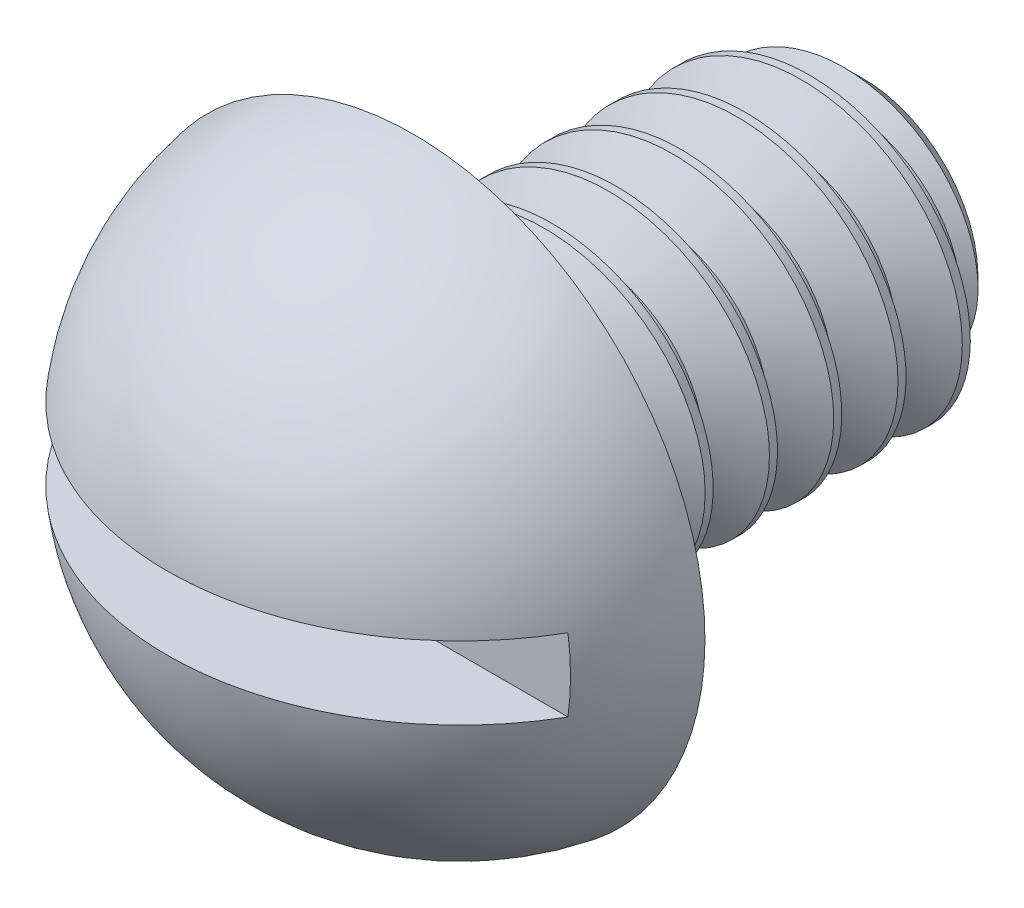
from build123d import *

# Parameters (mm, degrees)
SKETCH3_W          = 6.1722
SKETCH3_H          = 0.51435
CUT_EXTRUDE1_DEPTH = 1.05156
CHAMFER2_SIZE      = 0.03175
SPLIT1_START       = -2.4638
SPLIT1_OUTLINE_R   = 1.0922
SPLIT1_DEPTH       = 3.1115
CUT_SWEEP1_PITCH   = 0.453571429
CUT_SWEEP1_TO      = 3.1115


with BuildPart() as part:
    # Sketch2 → Revolve1 (revolve)
    with BuildSketch(Plane(origin=(0, 0, 0), x_dir=(0, 0, -1), z_dir=(1, 0, 0)), mode=Mode.PRIVATE) as revolve1_sk:
        with BuildLine():
            Line((-2.4638, 0), (2.4638, 0))
            Line((2.4638, 0), (2.4638, 0.808717857))
            Line((2.4638, 0.808717857), (2.180317857, 1.0922))
            Line((2.180317857, 1.0922), (-0.6477, 1.0922))
            Line((-0.6477, 1.0922), (-0.6477, 1.114044))
            Line((-0.6477, 1.114044), (-0.7112, 1.114044))
            Line((-0.7112, 1.114044), (-0.7112, 2.0574))
            ThreePointArc((-0.7112, 2.0574), (-1.96625373, 1.351342066), (-2.4638, 0))
        make_face()
    revolve(revolve1_sk.sketch.rotate(Axis((0, 0, 2.4638), (0, 0, -1)), 180), axis=Axis((0, 0, 2.4638), (0, 0, -1)))

    # Sketch3 → Cut-Extrude1 (cut)
    with BuildSketch(Plane.XY.offset(2.4638)):
        Rectangle(SKETCH3_W, SKETCH3_H)
    extrude(amount=-CUT_EXTRUDE1_DEPTH, mode=Mode.SUBTRACT)

    # Chamfer2
    chamfer2_edges = [part.edges().sort_by_distance(p)[0] for p in [
        (0, 1.114044, 0.7112),
    ]]
    chamfer(chamfer2_edges, length=CHAMFER2_SIZE)

    # Split1: read off the stored shape, not the designer's step
    # Split1 outline → Split1 (cut)
    with BuildSketch(Plane.XY.offset(SPLIT1_START)):
        Circle(SPLIT1_OUTLINE_R)
    extrude(amount=SPLIT1_DEPTH, mode=Mode.SUBTRACT)



with BuildPart() as body_2:
    # Split1 2 outline → Split1 2 (revolve)
    with BuildSketch(Plane.XZ):
        Polygon((1.0922, 0.6477), (0, 0.6477), (0, -2.4638), (0.808717857, -2.4638), (1.0922, -2.180317857), align=None)
    revolve(axis=Axis((0, 0, 0), (0, 0, 1)))

    # Cut-Sweep1: arcs per turn and ends read off the stored shape
    # Cut-Sweep1: the profile of Sketch5 screwed along a right-hand helix through 8 turns, 6 arcs to a turn; built about Z, then put on its axis
    cut_sweep1_z = Axis((0, 0, 0), (0, 0, 1))
    cut_sweep1_corners = [(0.797596715, 0, -0.170089286), (0.797596715, 0, -0.226785714), (1.116750274, 0, -0.411049107), (1.116750274, 0, 0.014174107)]
    with BuildLine(mode=Mode.PRIVATE) as cut_sweep1_profile:
        Line(cut_sweep1_corners[0], cut_sweep1_corners[1])
        Line(cut_sweep1_corners[1], cut_sweep1_corners[2])
        Line(cut_sweep1_corners[2], cut_sweep1_corners[3])
        Line(cut_sweep1_corners[3], cut_sweep1_corners[0])
    cut_sweep1_cap = Face(cut_sweep1_profile.wire())
    cut_sweep1_turn_angles = [0, 30, 60, 90, 120, 150, 180, 210, 240, 270, 300, 330, 360]
    cut_sweep1_turn_weights = [1, 0.8660254037844387, 1, 0.8660254037844387, 1, 0.8660254037844387, 1, 0.8660254037844387, 1, 0.8660254037844387, 1, 0.8660254037844387, 1]
    cut_sweep1_turn_rails = [Edge.make_bspline([Vector(p[0], p[1], 0).rotate(cut_sweep1_z, cut_sweep1_turn_angles[k]) / cut_sweep1_turn_weights[k] + Vector(0, 0, p[2] + CUT_SWEEP1_PITCH * cut_sweep1_turn_angles[k] / 360) for k in range(13)], [0, 0, 0, 1, 1, 2, 2, 3, 3, 4, 4, 5, 5, 6, 6, 6], 2, cut_sweep1_turn_weights) for p in cut_sweep1_corners]
    cut_sweep1_turn_sides = [Face.make_surface_from_curves(cut_sweep1_turn_rails[p[0]], cut_sweep1_turn_rails[p[1]]) for p in [(0, 1), (1, 2), (2, 3), (3, 0)]]
    cut_sweep1 = Plane(origin=(0, 0, -2.4638), x_dir=(0, 1, 0), z_dir=(0, 0, 1)) * split(Solid(Shell([*[p.moved(Location((0, 0, CUT_SWEEP1_PITCH * i))) for i in range(8) for p in cut_sweep1_turn_sides], cut_sweep1_cap, cut_sweep1_cap.rotate(cut_sweep1_z, 2880).moved(Location((0, 0, CUT_SWEEP1_PITCH * 2880 / 360)))])), bisect_by=Plane.XY.offset(CUT_SWEEP1_TO), keep=Keep.BOTTOM, mode=Mode.PRIVATE)
    add(cut_sweep1, mode=Mode.SUBTRACT)


with BuildPart() as part_1:
    add(part.part)

    add(body_2.part)  # Boss-Extrude1 merges body 2
    # Boss-Extrude1: read off the stored shape, not the designer's step
    # Boss-Extrude1 outline → Boss-Extrude1 (revolve)
    with BuildSketch(Plane.XZ):
        Polygon((0.797590436, 0.6477), (0.797590436, 0.550930573), (0.9652, 0.6477), align=None)
    revolve(axis=Axis((0, 0, 0), (0, 0, 1)))


solid = part_1.part
